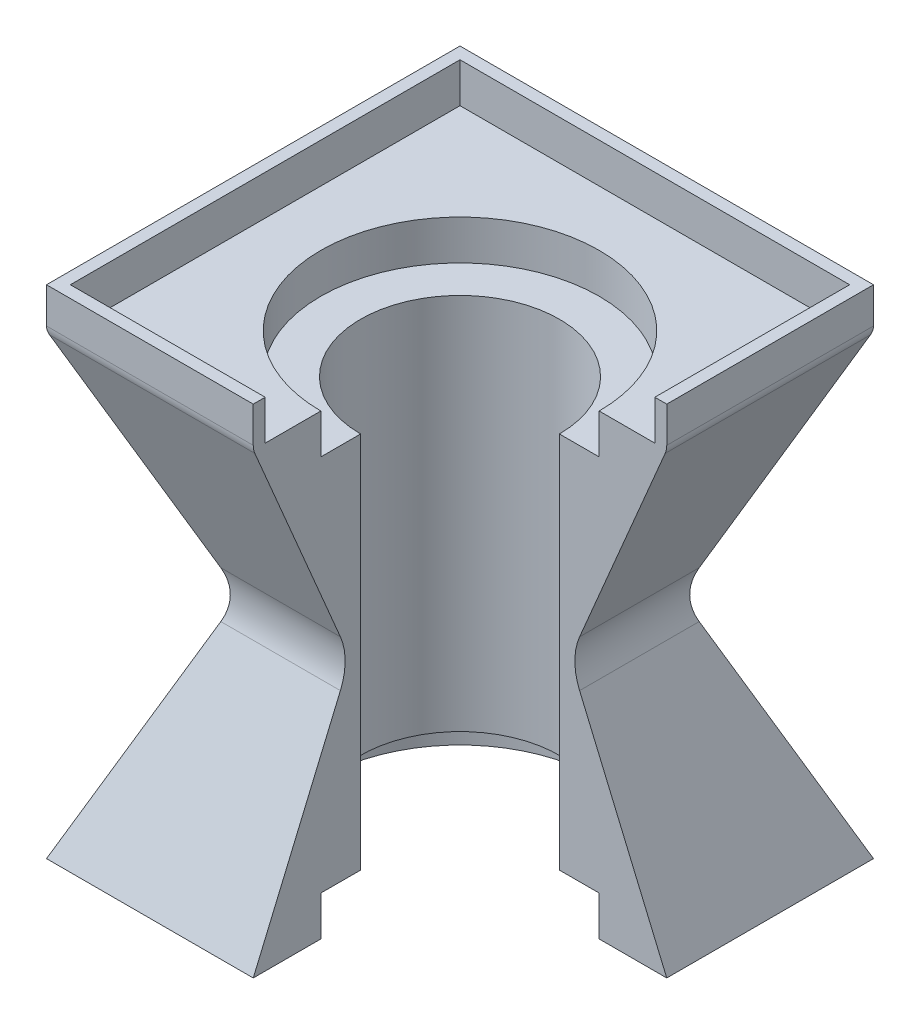
from build123d import *

# Parameters (mm, degrees)
SKETCH1_W           = 104
SKETCH1_H           = 104
BOSS_EXTRUDE1_DEPTH = 57.5
BOSS_EXTRUDE1_TAPER = 23
SKETCH2_R           = 25
CUT_EXTRUDE2_DEPTH  = 137.502747386
SKETCH3_R           = 35
CUT_EXTRUDE4_DEPTH  = 10
CUT_EXTRUDE5_START  = -10
SKETCH4_R           = 35
CUT_EXTRUDE5_DEPTH  = 10
SKETCH5_W           = 52
SKETCH5_H           = 52
CUT_EXTRUDE6_DEPTH  = 137.502747386
FILLET1_R           = 15
BOSS_EXTRUDE3_DEPTH = 10
FILLET2_R           = 5


with BuildPart() as part:
    # Sketch1 → Boss-Extrude1 (new body)
    with BuildSketch(Plane(origin=(0, 0, 0), x_dir=(1, 0, 0), z_dir=(0, 1, 0))):
        Rectangle(SKETCH1_W, SKETCH1_H)
    extrude(amount=BOSS_EXTRUDE1_DEPTH, taper=BOSS_EXTRUDE1_TAPER)

    # Mirror1: part across plane


with BuildPart() as part_1:
    add(part.part)
    add(part.part.mirror(Plane.ZX.offset(57.5)))

    # Sketch2 → Cut-Extrude2 (cut, through all)
    with BuildSketch(Plane(origin=(0, 115, 0), x_dir=(1, 0, 0), z_dir=(0, 1, 0))):
        with Locations(Location((0, 0, 0), (0, 0, 270))):
            Circle(SKETCH2_R)
    extrude(amount=-CUT_EXTRUDE2_DEPTH, mode=Mode.SUBTRACT)

    # Sketch3 → Cut-Extrude4 (cut)
    with BuildSketch(Plane(origin=(0, 115, 0), x_dir=(1, 0, 0), z_dir=(0, 1, 0))):
        with Locations(Location((0, 0, 0), (0, 0, 270))):
            Circle(SKETCH3_R)
    extrude(amount=-CUT_EXTRUDE4_DEPTH, mode=Mode.SUBTRACT)

    # Sketch4 → Cut-Extrude5 (cut)
    with BuildSketch(Plane.XZ.offset(CUT_EXTRUDE5_START)):
        with Locations(Location((0, 0, 0), (0, 0, 90))):
            Circle(SKETCH4_R)
    extrude(amount=CUT_EXTRUDE5_DEPTH, mode=Mode.SUBTRACT)

    # Sketch5 → Cut-Extrude6 (cut, through all)
    with BuildSketch(Plane(origin=(0, 115, 0), x_dir=(1, 0, 0), z_dir=(0, 1, 0))):
        with Locations((26, -26)):
            Rectangle(SKETCH5_W, SKETCH5_H)
    extrude(amount=-CUT_EXTRUDE6_DEPTH, mode=Mode.SUBTRACT)

    # Fillet1
    # the kernel refuses this fillet: 15 mm, written as the material it adds along each edge
    with BuildSketch(Plane(origin=(43.510503676, 57.5, -27.592698068), x_dir=(0, -0.9205048534524403, -0.3907311284892741), z_dir=(-1, 0, 0))) as fillet1_piece_1_section:
        with BuildLine():
            CenterArc((FILLET1_R * 0.42447481621, -FILLET1_R), FILLET1_R, 90, 46)
            Line((-FILLET1_R * 0.294864984129, -FILLET1_R * 0.305341629541), (0, 0))
            Line((0, 0), (FILLET1_R * 0.42447481621, 0))
        make_face()
    fillet1_piece_1 = extrude(amount=87.021007352, mode=Mode.PRIVATE)
    fillet1_piece_1 = fillet1_piece_1 - Plane(origin=(43.888103729, 57.5, -27.592698068), x_dir=(-0.9205048534524399, -0.39073112848927477, 0), z_dir=(0, 0, 1)) * Cylinder(15, 200, mode=Mode.PRIVATE)
    fillet1_piece_1 = fillet1_piece_1 - Plane(origin=(-43.888103729, 57.5, -27.592698068), x_dir=(0.9205048534524399, -0.3907311284892748, 0), z_dir=(0, 0, -1)) * Cylinder(15, 200, mode=Mode.PRIVATE)
    add(fillet1_piece_1)
    with BuildSketch(Plane(origin=(-27.592698068, 57.5, -43.510503676), x_dir=(-0.3907311284892741, -0.9205048534524403, 0), z_dir=(0, 0, 1))) as fillet1_piece_2_section:
        with BuildLine():
            CenterArc((FILLET1_R * 0.42447481621, -FILLET1_R), FILLET1_R, 90, 46)
            Line((-FILLET1_R * 0.294864984129, -FILLET1_R * 0.305341629541), (0, 0))
            Line((0, 0), (FILLET1_R * 0.42447481621, 0))
        make_face()
    fillet1_piece_2 = extrude(amount=87.021007352, mode=Mode.PRIVATE)
    fillet1_piece_2 = fillet1_piece_2 - Plane(origin=(-27.592698068, 57.5, 43.888103729), x_dir=(0, -0.39073112848927466, -0.9205048534524399), z_dir=(-1, 0, 0)) * Cylinder(15, 200, mode=Mode.PRIVATE)
    fillet1_piece_2 = fillet1_piece_2 - Plane(origin=(-27.592698068, 57.5, -43.888103729), x_dir=(0, -0.39073112848927477, 0.9205048534524399), z_dir=(1, 0, 0)) * Cylinder(15, 200, mode=Mode.PRIVATE)
    add(fillet1_piece_2)
    with BuildSketch(Plane(origin=(-43.510503676, 57.5, 27.592698068), x_dir=(0, -0.9205048534524398, 0.39073112848927505), z_dir=(1, 0, 0))) as fillet1_piece_3_section:
        with BuildLine():
            CenterArc((FILLET1_R * 0.42447481621, -FILLET1_R), FILLET1_R, 90, 46)
            Line((-FILLET1_R * 0.294864984129, -FILLET1_R * 0.305341629541), (0, 0))
            Line((0, 0), (FILLET1_R * 0.42447481621, 0))
        make_face()
    fillet1_piece_3 = extrude(amount=43.510503676, mode=Mode.PRIVATE)
    fillet1_piece_3 = fillet1_piece_3 - Plane(origin=(-43.888103729, 57.5, 27.592698068), x_dir=(0.9205048534524399, -0.3907311284892748, 0), z_dir=(0, 0, -1)) * Cylinder(15, 113, mode=Mode.PRIVATE)
    add(fillet1_piece_3)
    with BuildSketch(Plane(origin=(27.592698068, 57.5, 0), x_dir=(0.3907311284892755, -0.9205048534524396, 0), z_dir=(0, 0, -1))) as fillet1_piece_4_section:
        with BuildLine():
            CenterArc((FILLET1_R * 0.42447481621, -FILLET1_R), FILLET1_R, 90, 46)
            Line((-FILLET1_R * 0.294864984129, -FILLET1_R * 0.305341629541), (0, 0))
            Line((0, 0), (FILLET1_R * 0.42447481621, 0))
        make_face()
    fillet1_piece_4 = extrude(amount=43.510503676, mode=Mode.PRIVATE)
    fillet1_piece_4 = fillet1_piece_4 - Plane(origin=(27.592698068, 57.5, -43.888103729), x_dir=(0, -0.39073112848927477, 0.9205048534524399), z_dir=(1, 0, 0)) * Cylinder(15, 113, mode=Mode.PRIVATE)
    add(fillet1_piece_4)

    # Sketch6 → Boss-Extrude3 (add)
    with BuildSketch(Plane(origin=(0, 115, 0), x_dir=(1, 0, 0), z_dir=(0, 1, 0))):
        Polygon((49, 3), (49, 0), (52, 0), (52, 52), (-52, 52), (-52, -52), (0, -52), (0, -49), (-3, -49), (-49, -49), (-49, 49), (49, 49), align=None)
    extrude(amount=BOSS_EXTRUDE3_DEPTH)

    # Fillet2
    fillet2_edges = [part_1.edges().sort_by_distance(p)[0] for p in [
        (0, 115, -52),
        (-52, 115, 0),
        (-26, 115, 52),
        (52, 115, -26),
    ]]
    fillet(fillet2_edges, radius=FILLET2_R)


solid = part_1.part
